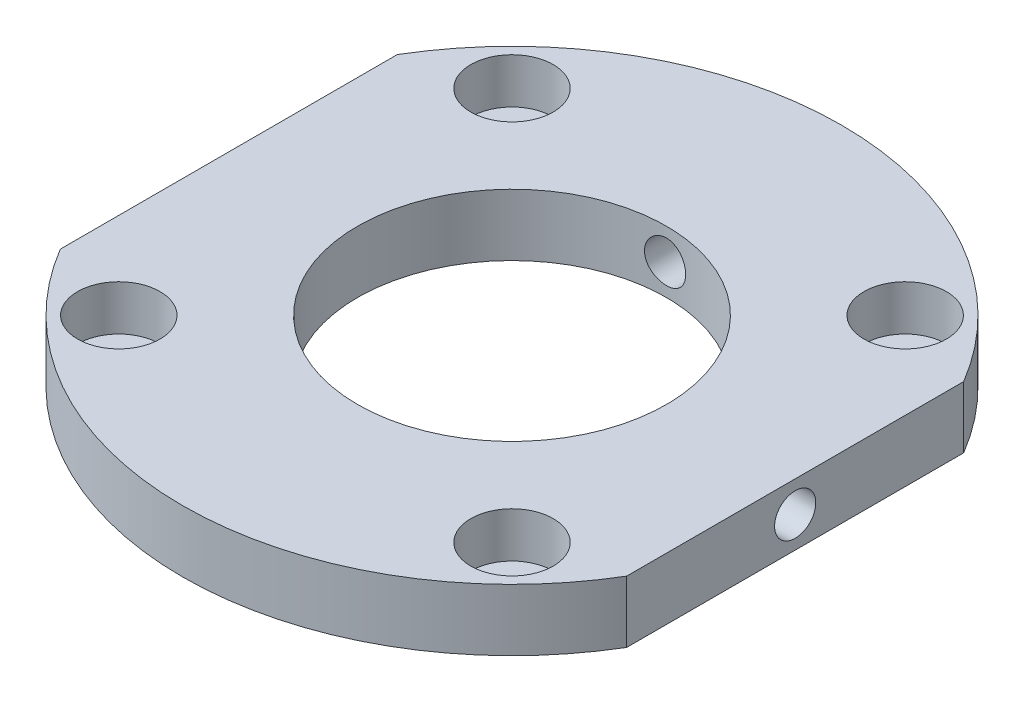
from build123d import *

# Parameters (mm, degrees)
SKETCH1_R                                           = 32
SKETCH1_R_2                                         = 15
BOSS_EXTRUDE1_DEPTH                                 = 6
CBORE_FOR_M4_HEX_SOCKET_HEAD_CAP_SCREW2_D           = 4.3
CBORE_FOR_M4_HEX_SOCKET_HEAD_CAP_SCREW2_DEPTH       = 11.94
CBORE_FOR_M4_HEX_SOCKET_HEAD_CAP_SCREW2_CBORE_D     = 8
CBORE_FOR_M4_HEX_SOCKET_HEAD_CAP_SCREW2_CBORE_DEPTH = 4.4
CBORE_FOR_M4_HEX_SOCKET_HEAD_CAP_SCREW2_TIP         = 1.291850331
SKETCH7_R                                           = 2
CUT_EXTRUDE1_DEPTH                                  = 44.5
SKETCH8_R                                           = 2
CUT_EXTRUDE2_DEPTH                                  = 44.5
CUT_EXTRUDE3_START                                  = -10
CUT_EXTRUDE3_DEPTH                                  = 10


with BuildPart() as part:
    # Sketch1 → Boss-Extrude1 (new body)
    with BuildSketch(Plane(origin=(0, 0, 0), x_dir=(1, 0, 0), z_dir=(0, 1, 0))):
        Circle(SKETCH1_R)
        Circle(SKETCH1_R_2, mode=Mode.SUBTRACT)
    extrude(amount=BOSS_EXTRUDE1_DEPTH)

    # CBORE for M4 Hex Socket Head Cap Screw2
    with Locations(Plane(origin=(0, 6, 0), x_dir=(1, 0, 0), z_dir=(0, 1, 0))):
        with Locations((19.091883092, 19.091883092), (19.091883092, -19.091883092), (-19.091883092, -19.091883092), (-19.091883092, 19.091883092)):
            CounterBoreHole(CBORE_FOR_M4_HEX_SOCKET_HEAD_CAP_SCREW2_D / 2, CBORE_FOR_M4_HEX_SOCKET_HEAD_CAP_SCREW2_CBORE_D / 2, CBORE_FOR_M4_HEX_SOCKET_HEAD_CAP_SCREW2_CBORE_DEPTH, depth=CBORE_FOR_M4_HEX_SOCKET_HEAD_CAP_SCREW2_DEPTH)
            with Locations((0, 0, -(CBORE_FOR_M4_HEX_SOCKET_HEAD_CAP_SCREW2_DEPTH + CBORE_FOR_M4_HEX_SOCKET_HEAD_CAP_SCREW2_TIP / 2))):  # 118° drill point
                Cone(0, CBORE_FOR_M4_HEX_SOCKET_HEAD_CAP_SCREW2_D / 2, CBORE_FOR_M4_HEX_SOCKET_HEAD_CAP_SCREW2_TIP, mode=Mode.SUBTRACT)

    # Sketch7 → Cut-Extrude1 (cut)
    with BuildSketch(Plane(origin=(0, 0, 0), x_dir=(0, 0, -1), z_dir=(1, 0, 0))):
        with Locations((0, 3)):
            Circle(SKETCH7_R)
    extrude(amount=CUT_EXTRUDE1_DEPTH, mode=Mode.SUBTRACT)

    # Sketch8 → Cut-Extrude2 (cut)
    with BuildSketch(Plane.XY):
        with Locations((0, 3)):
            Circle(SKETCH8_R)
    extrude(amount=-CUT_EXTRUDE2_DEPTH, mode=Mode.SUBTRACT)

    # Sketch9 → Cut-Extrude3 (cut)
    with BuildSketch(Plane(origin=(0, 6, 0), x_dir=(1, 0, 0), z_dir=(0, 1, 0)).offset(CUT_EXTRUDE3_START)):
        with BuildLine():
            Line((-27.5, 16.363068172), (-27.5, -16.363068172))
            ThreePointArc((-27.5, -16.363068172), (-32, 0), (-27.5, 16.363068172))
        make_face()
        with BuildLine():
            Line((27.5, -16.363068172), (27.5, 16.363068172))
            ThreePointArc((27.5, 16.363068172), (32, 0), (27.5, -16.363068172))
        make_face()
    extrude(amount=CUT_EXTRUDE3_DEPTH, mode=Mode.SUBTRACT)


solid = part.part
